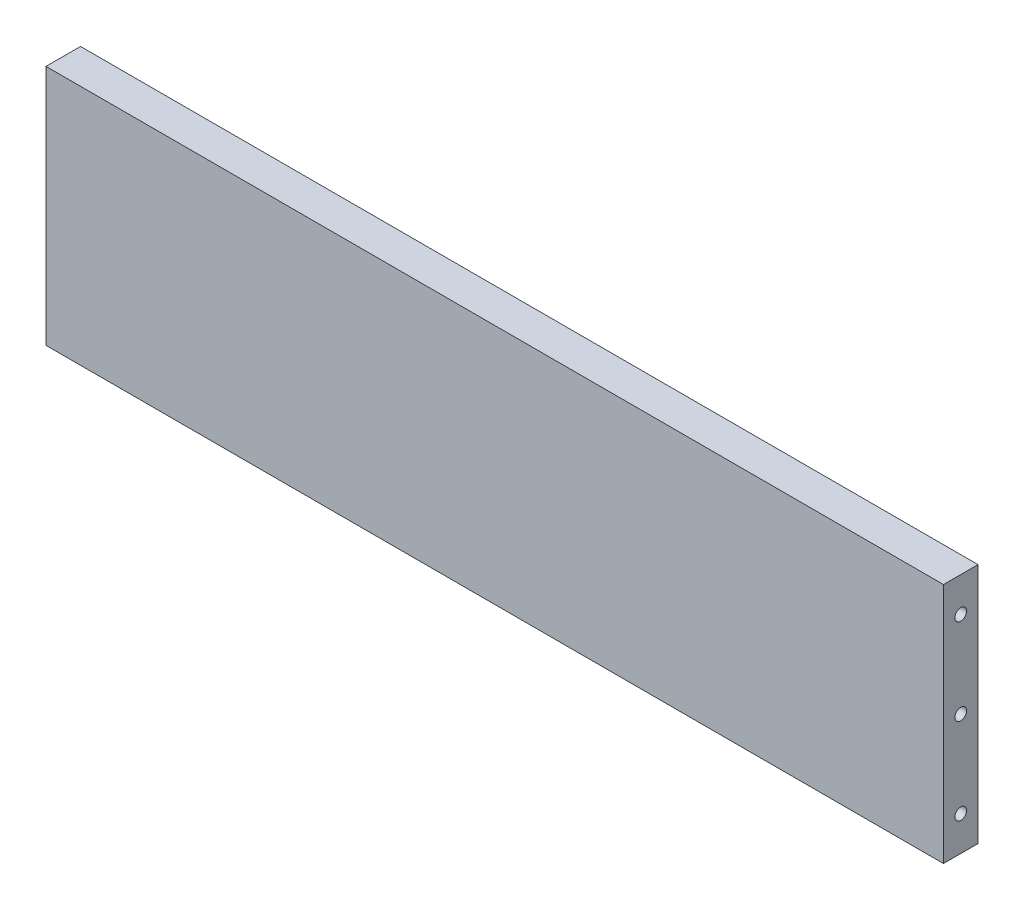
from build123d import *

# Parameters (mm, degrees)
SKETCH1_W           = 330.2
SKETCH1_H           = 88.9
BOSS_EXTRUDE1_DEPTH = 12.7
SKETCH3_R           = 2.1463
CUT_EXTRUDE1_DEPTH  = 38.1
CUT_EXTRUDE2_START  = -38.1
SKETCH5_R           = 2.1463
CUT_EXTRUDE2_DEPTH  = 38.1


with BuildPart() as part:
    # Sketch1 → Boss-Extrude1 (new body)
    with BuildSketch(Plane.XY):
        with Locations((165.1, 44.45)):
            Rectangle(SKETCH1_W, SKETCH1_H)
    extrude(amount=BOSS_EXTRUDE1_DEPTH)

    # Sketch3 → Cut-Extrude1 (cut)
    with BuildSketch(Plane.ZY):
        with Locations((6.35, 76.2)):
            Circle(SKETCH3_R)
        with Locations((6.35, 12.7)):
            Circle(SKETCH3_R)
        with Locations((6.35, 44.45)):
            Circle(SKETCH3_R)
    extrude(amount=-CUT_EXTRUDE1_DEPTH, mode=Mode.SUBTRACT)

    # Sketch5 → Cut-Extrude2 (cut)
    with BuildSketch(Plane(origin=(330.2, 0, 0), x_dir=(0, 0, -1), z_dir=(1, 0, 0)).offset(CUT_EXTRUDE2_START)):
        with Locations((-6.35, 76.2)):
            Circle(SKETCH5_R)
        with Locations((-6.35, 12.7)):
            Circle(SKETCH5_R)
        with Locations((-6.35, 44.45)):
            Circle(SKETCH5_R)
    extrude(amount=CUT_EXTRUDE2_DEPTH, mode=Mode.SUBTRACT)


solid = part.part
